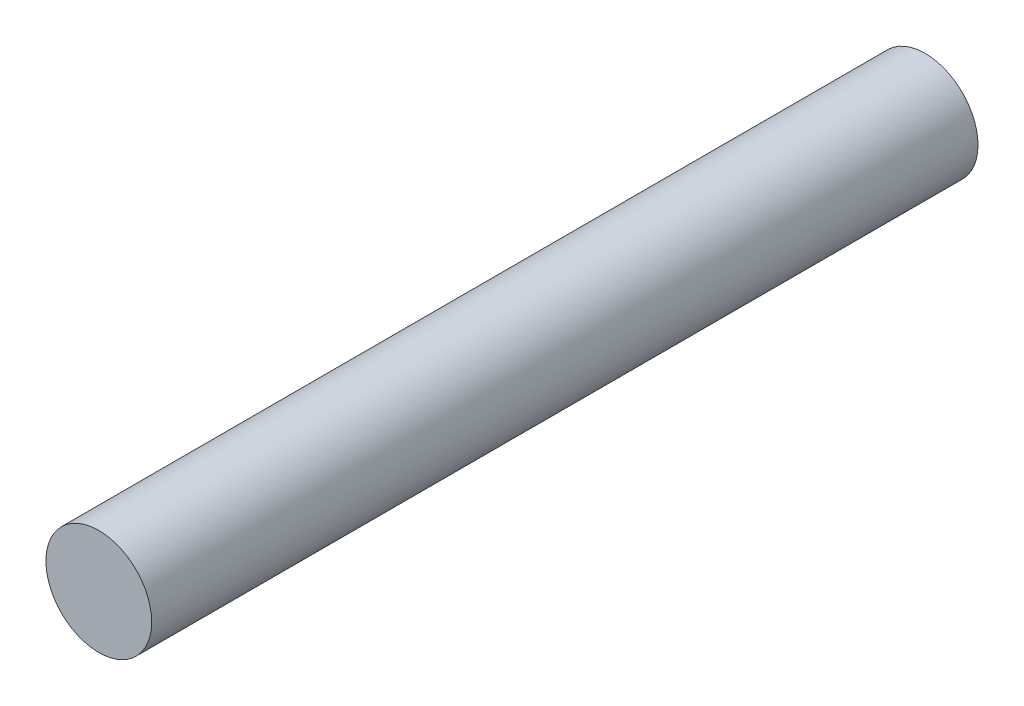
from build123d import *

# Parameters (mm, degrees)
ESQUISSE1_R = 1.6
MAIN_DEPTH  = 25


with BuildPart() as part:
    # Esquisse1 → Main (new body)
    with BuildSketch(Plane.XY):
        Circle(ESQUISSE1_R)
    extrude(amount=MAIN_DEPTH)


solid = part.part
